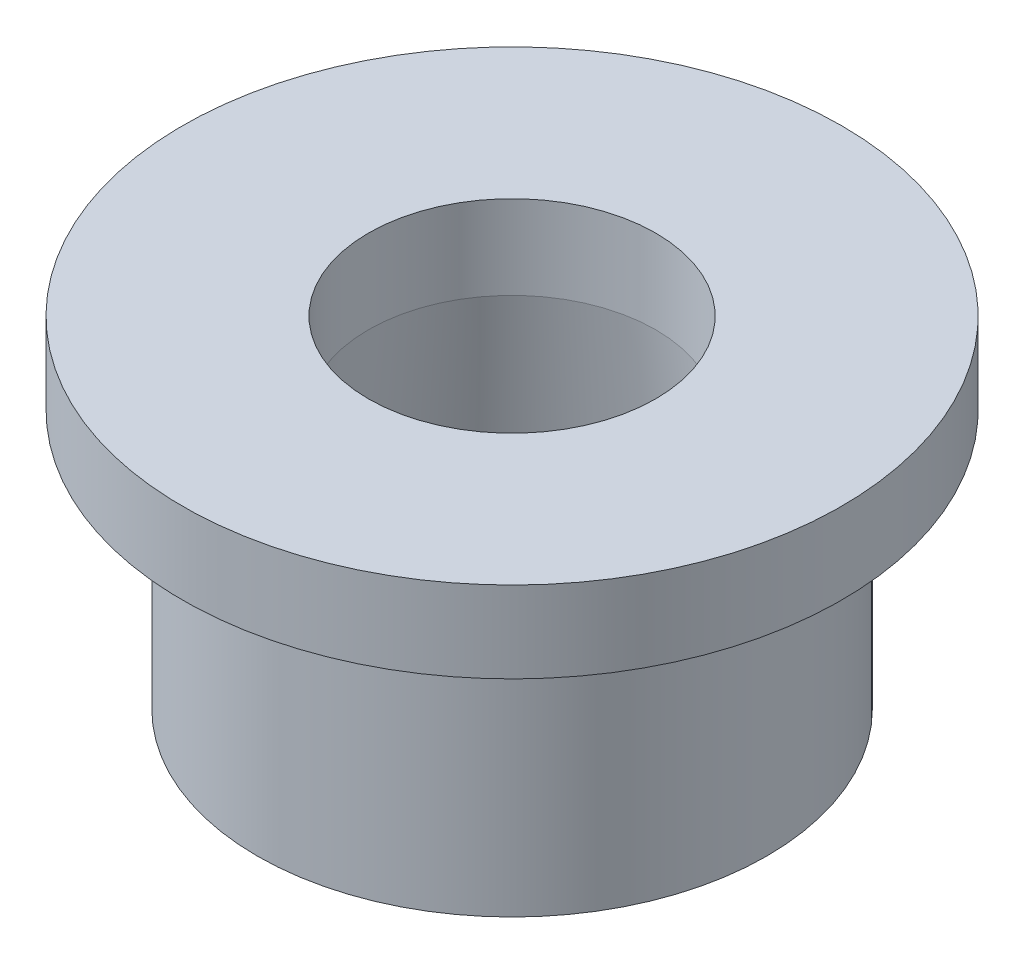
from build123d import *


with BuildPart() as part:
    # Sketch1 → Revolve1 (revolve)
    with BuildSketch(Plane.XY):
        Polygon((3.3655, 7.9756), (3.3655, 6.013808148), (4.064, 0), (5.969, 0), (5.969, 4.9784), (7.7216, 6.0706), (7.7216, 7.9756), align=None)
    revolve(axis=Axis((0, 0, 0), (0, 1, 0)))


solid = part.part
